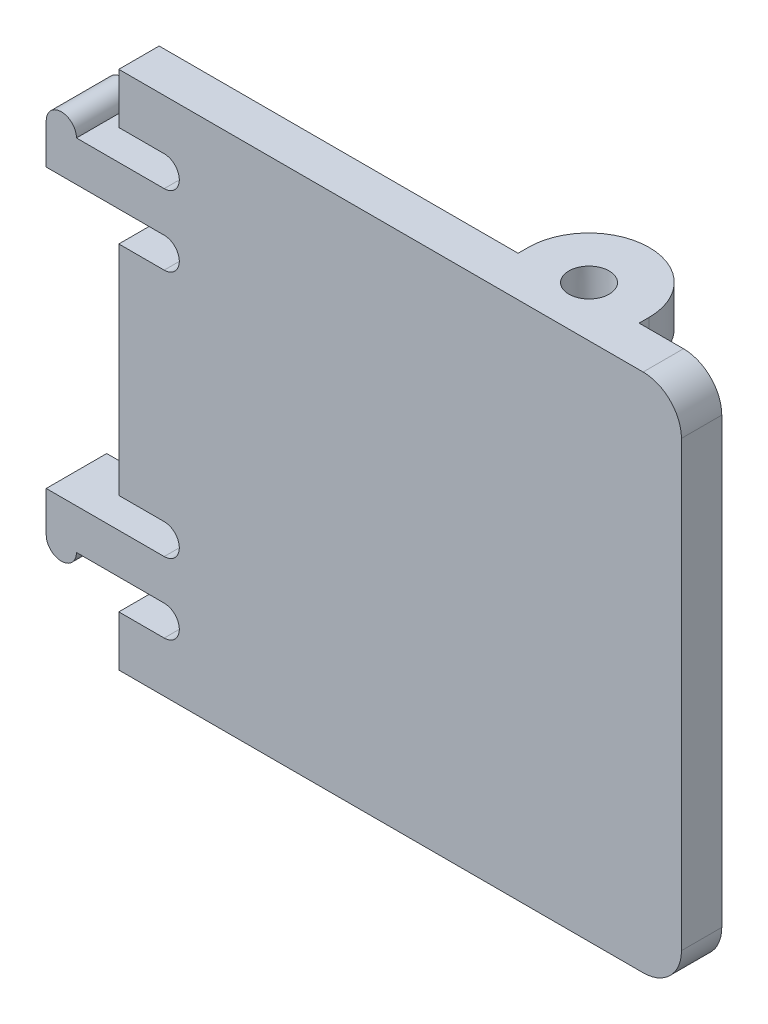
from build123d import *

# Parameters (mm, degrees)
EXTRUDE_1_DEPTH     = 2
SKETCH_2_W          = 6
SKETCH_2_H          = 2
EXTRUDE_2_DEPTH     = 3.5
FILLET_1_R          = 3
SKETCH_3_R          = 1
CUT_EXTRUDE_1_DEPTH = 5
CUT_EXTRUDE_1_DRAFT = -2
SKETCH_4_R          = 1
CUT_EXTRUDE_2_DEPTH = 5
CUT_EXTRUDE_2_DRAFT = -2
SKETCH_6_W          = 3.6
SKETCH_6_H          = 2
EXTRUDE_3_DEPTH     = 3
CHAMFER_1_SIZE      = 3
SKETCH_7_R          = 0.75
EXTRUDE_4_DEPTH     = 3
CUT_EXTRUDE_3_REACH = 30.118
SKETCH_8_W          = 3
SKETCH_8_H          = 1.5
FILLET_2_R          = 0.75


# Some blends are built 0.0001 mm under size
with BuildPart() as part:
    # 草图1 → 凸台-拉伸1 (new body)
    with BuildSketch(Plane.XY):
        with BuildLine():
            Line((-11.942385676, 3.311338927), (-11.942385676, -22.488661073))
            Line((-11.942385676, -22.488661073), (14.057614324, -22.488661073))
            ThreePointArc((14.057614324, -22.488661073), (15.401117208, -21.932163957), (15.957614324, -20.588661073))
            Line((15.957614324, -20.588661073), (15.957614324, 1.411338927))
            ThreePointArc((15.957614324, 1.411338927), (15.401117208, 2.754841811), (14.057614324, 3.311338927))
            Line((14.057614324, 3.311338927), (-11.942385676, 3.311338927))
        make_face()
    extrude(amount=-EXTRUDE_1_DEPTH)

    # 草图2 → 凸台-拉伸2 (add)
    with BuildSketch(Plane(origin=(0, 0, -2), x_dir=(-1, 0, 0), z_dir=(0, 0, -1))):
        with Locations((-8.857614324, -21.488661073)):
            Rectangle(SKETCH_2_W, SKETCH_2_H)
        with Locations((-8.857614324, 2.311338927)):
            Rectangle(SKETCH_2_W, SKETCH_2_H)
    extrude(amount=EXTRUDE_2_DEPTH)

    # 圆角1
    fillet_1_edges = [part.edges().sort_by_distance(p)[0] for p in [
        (11.857614324, 2.311338927, -5.5),
        (5.857614324, 2.311338927, -5.5),
        (11.857614324, -21.488661073, -5.5),
        (5.857614324, -21.488661073, -5.5),
    ]]
    fillet(fillet_1_edges, radius=FILLET_1_R - 0.0001)  # a hair under: the kernel refuses the full size


with BuildPart() as cut_extrude_1_tool:
    # 草图3 → 切除-拉伸1 (with draft: the straight prism first)
    with BuildSketch(Plane.XZ.offset(22.488661073)):
        with Locations((8.874069652, -2.5)):
            Circle(SKETCH_3_R)
    extrude(amount=-CUT_EXTRUDE_1_DEPTH)
    # 切除-拉伸1: the draft: its side faces are tilted about the plane it starts from
    cut_extrude_1_sides = [cut_extrude_1_tool.faces().sort_by_distance(p)[0] for p in [
        (7.874069652, -19.988661073, -2.5),
    ]]
    draft(cut_extrude_1_sides, Plane.XZ.offset(22.488661073), CUT_EXTRUDE_1_DRAFT)


with BuildPart() as part_1:
    add(part.part)

    # 切除-拉伸1: cut by cut_extrude_1_tool
    add(cut_extrude_1_tool.part, mode=Mode.SUBTRACT)


with BuildPart() as cut_extrude_2_tool:
    # 草图4 → 切除-拉伸2 (with draft: the straight prism first)
    with BuildSketch(Plane(origin=(0, 3.311338927, 0), x_dir=(1, 0, 0), z_dir=(0, 1, 0))):
        with Locations((8.874069652, 2.5)):
            Circle(SKETCH_4_R)
    extrude(amount=-CUT_EXTRUDE_2_DEPTH)
    # 切除-拉伸2: the draft: its side faces are tilted about the plane it starts from
    cut_extrude_2_sides = [cut_extrude_2_tool.faces().sort_by_distance(p)[0] for p in [
        (7.874069652, 0.811338927, -2.5),
    ]]
    draft(cut_extrude_2_sides, Plane(origin=(0, 3.311338927, 0), x_dir=(1, 0, 0), z_dir=(0, 1, 0)), CUT_EXTRUDE_2_DRAFT)


with BuildPart() as part_2:
    add(part_1.part)

    # 切除-拉伸2: cut by cut_extrude_2_tool
    add(cut_extrude_2_tool.part, mode=Mode.SUBTRACT)

    # 草图6 → 凸台-拉伸3 (add)
    with BuildSketch(Plane.XY):
        with Locations((-13.742385676, -1.688661073)):
            Rectangle(SKETCH_6_W, SKETCH_6_H)
        with Locations((-13.742385676, -17.488661073)):
            Rectangle(SKETCH_6_W, SKETCH_6_H)
    extrude(amount=-EXTRUDE_3_DEPTH)

    # 倒角1
    # the kernel refuses this chamfer: 3 mm, written as the material it adds along each edge
    with BuildSketch(Plane(origin=(-11.942385676, -16.488661073, -2), x_dir=(0.9996219169112969, 0, 0.027495876610586355), z_dir=(0, -1, 0))) as chamfer_1_piece_1_section:
        Polygon((CHAMFER_1_SIZE * 0.999621916911, -CHAMFER_1_SIZE * 0.0274958766106), (-CHAMFER_1_SIZE * 0.0274958766106, -CHAMFER_1_SIZE * 0.999621916911), (0, 0), align=None)
    chamfer_1_piece_1 = extrude(amount=2, mode=Mode.PRIVATE)
    chamfer_1_piece_1 = split(chamfer_1_piece_1, bisect_by=Plane(origin=(-10.675719009, -17.488661073, -3), z_dir=(0, 0, 1)), keep=Keep.TOP, mode=Mode.PRIVATE)
    add(chamfer_1_piece_1)
    with BuildSketch(Plane(origin=(-11.942385676, -0.688661073, -2), x_dir=(0.9996219169112969, 0, 0.027495876610586355), z_dir=(0, -1, 0))) as chamfer_1_piece_2_section:
        Polygon((CHAMFER_1_SIZE * 0.999621916911, -CHAMFER_1_SIZE * 0.0274958766106), (-CHAMFER_1_SIZE * 0.0274958766106, -CHAMFER_1_SIZE * 0.999621916911), (0, 0), align=None)
    chamfer_1_piece_2 = extrude(amount=2, mode=Mode.PRIVATE)
    chamfer_1_piece_2 = split(chamfer_1_piece_2, bisect_by=Plane(origin=(-10.675719009, -1.688661073, -3), z_dir=(0, 0, 1)), keep=Keep.TOP, mode=Mode.PRIVATE)
    add(chamfer_1_piece_2)

    # 草图7 → 凸台-拉伸4 (add)
    with BuildSketch(Plane.XY):
        with Locations((-14.792385676, -0.688661073)):
            Circle(SKETCH_7_R)
        with Locations((-14.792385676, -18.488661073)):
            Circle(SKETCH_7_R)
    extrude(amount=-EXTRUDE_4_DEPTH)

    # 草图8 → 切除-拉伸3 (cut, up to next)
    with BuildSketch(Plane.XY, mode=Mode.PRIVATE) as cut_extrude_3_sk1:
        with Locations((-10.442385676, -3.438661073)):
            Rectangle(SKETCH_8_W, SKETCH_8_H)
    cut_extrude_3_tool1 = extrude(cut_extrude_3_sk1.sketch, amount=-CUT_EXTRUDE_3_REACH, mode=Mode.PRIVATE) & part_2.part
    # 草图8 → 切除-拉伸3 (cut, up to next)
    with BuildSketch(Plane.XY, mode=Mode.PRIVATE) as cut_extrude_3_sk2:
        with Locations((-10.442385676, 0.061338927)):
            Rectangle(SKETCH_8_W, SKETCH_8_H)
    cut_extrude_3_tool2 = extrude(cut_extrude_3_sk2.sketch, amount=-CUT_EXTRUDE_3_REACH, mode=Mode.PRIVATE) & part_2.part
    # 草图8 → 切除-拉伸3 (cut, up to next)
    with BuildSketch(Plane.XY, mode=Mode.PRIVATE) as cut_extrude_3_sk3:
        with Locations((-10.442385676, -15.738661073)):
            Rectangle(SKETCH_8_W, SKETCH_8_H)
    cut_extrude_3_tool3 = extrude(cut_extrude_3_sk3.sketch, amount=-CUT_EXTRUDE_3_REACH, mode=Mode.PRIVATE) & part_2.part
    # 草图8 → 切除-拉伸3 (cut, up to next)
    with BuildSketch(Plane.XY, mode=Mode.PRIVATE) as cut_extrude_3_sk4:
        with Locations((-10.442385676, -19.238661073)):
            Rectangle(SKETCH_8_W, SKETCH_8_H)
    cut_extrude_3_tool4 = extrude(cut_extrude_3_sk4.sketch, amount=-CUT_EXTRUDE_3_REACH, mode=Mode.PRIVATE) & part_2.part
    add(cut_extrude_3_tool1.solids().sort_by_distance((-10.442386, -3.438661, 0))[0], mode=Mode.SUBTRACT)
    add(cut_extrude_3_tool2.solids().sort_by_distance((-10.442386, 0.061339, 0))[0], mode=Mode.SUBTRACT)
    add(cut_extrude_3_tool3.solids().sort_by_distance((-10.442386, -15.738661, 0))[0], mode=Mode.SUBTRACT)
    add(cut_extrude_3_tool4.solids().sort_by_distance((-10.442386, -19.238661, 0))[0], mode=Mode.SUBTRACT)

    # 圆角2
    fillet_2_edges = [part_2.edges().sort_by_distance(p)[0] for p in [
        (-8.942385676, -2.688661073, -1),
        (-8.942385676, 0.811338927, -1),
        (-8.942385676, -18.488661073, -1),
        (-8.942385676, -14.988661073, -1),
        (-8.942385676, -19.988661073, -1),
        (-8.942385676, -16.488661073, -1),
        (-8.942385676, -4.188661073, -1),
        (-8.942385676, -0.688661073, -1),
    ]]
    fillet(fillet_2_edges, radius=FILLET_2_R - 0.0001)  # a hair under: the kernel refuses the full size


solid = part_2.part
